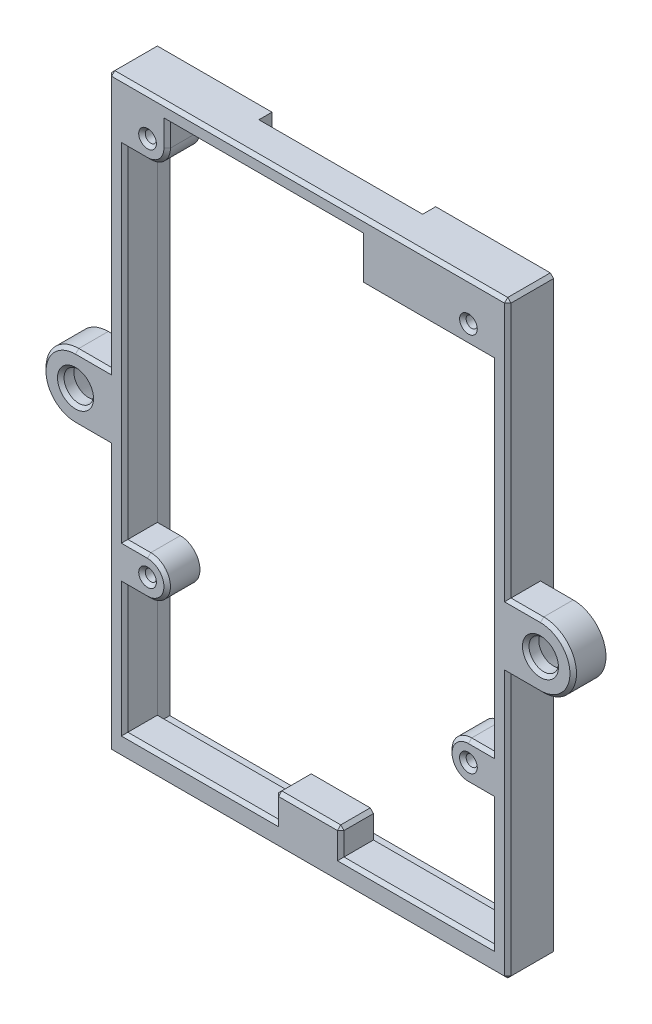
from build123d import *
from OCP.BRepFilletAPI import BRepFilletAPI_MakeChamfer

# Parameters (mm, degrees)
SKETCH1_R           = 0.85
BOSS_EXTRUDE1_DEPTH = 5
SKETCH2_W           = 56.2
SKETCH2_H           = 85.2
BOSS_EXTRUDE2_DEPTH = 2
SKETCH3_R           = 2.25
BOSS_EXTRUDE3_DEPTH = 5
SKETCH4_R           = 3.5
CUT_EXTRUDE1_DEPTH  = 3
SKETCH5_W           = 25
SKETCH5_H           = 2.4
CUT_EXTRUDE2_DEPTH  = 62.118736898
CHAMFER3_SIZE       = 0.5
CHAMFER1_SIZE       = 2.5
CHAMFER1_SIZE_2     = 1.25


with BuildPart() as part:
    # Sketch1 → Boss-Extrude1 (new body)
    with BuildSketch(Plane.XY):
        Polygon((-30.5, -43), (-30.5, 44.5), (30.5, 44.5), (30.5, -43), (30.5, -45.5), (-30.5, -45.5), align=None)
        with Locations((-24.5, 38.5)):
            Circle(SKETCH1_R, mode=Mode.SUBTRACT)
        with Locations((24.5, 38.5)):
            Circle(SKETCH1_R, mode=Mode.SUBTRACT)
        with Locations((24.5, -19.5)):
            Circle(SKETCH1_R, mode=Mode.SUBTRACT)
        with Locations((-24.5, -19.5)):
            Circle(SKETCH1_R, mode=Mode.SUBTRACT)
        with BuildLine():
            Line((-21.5, 38.5), (-21.5, 42))
            Line((-21.5, 42), (8, 42))
            Line((8, 42), (8, 35.5))
            Line((8, 35.5), (24.5, 35.5))
            Line((24.5, 35.5), (28, 35.5))
            Line((28, 35.5), (28, -16.5))
            Line((28, -16.5), (24.5, -16.5))
            ThreePointArc((24.5, -16.5), (21.5, -19.5), (24.5, -22.5))
            Line((24.5, -22.5), (28, -22.5))
            Line((28, -22.5), (28, -42))
            Line((28, -42), (5, -42))
            Line((5, -42), (5, -38))
            Line((5, -38), (0, -38))
            Line((0, -38), (-5, -38))
            Line((-5, -38), (-5, -42))
            Line((-5, -42), (-28, -42))
            Line((-28, -42), (-28, -22.5))
            Line((-28, -22.5), (-24.5, -22.5))
            ThreePointArc((-24.5, -22.5), (-21.5, -19.5), (-24.5, -16.5))
            Line((-24.5, -16.5), (-28, -16.5))
            Line((-28, -16.5), (-28, 35.5))
            Line((-28, 35.5), (-24.5, 35.5))
            ThreePointArc((-24.5, 35.5), (-22.378679656, 36.378679656), (-21.5, 38.5))
        make_face(mode=Mode.SUBTRACT)
    extrude(amount=BOSS_EXTRUDE1_DEPTH)

    # Sketch2 → Boss-Extrude2 (add)
    with BuildSketch(Plane.XY):
        Polygon((30.5, -45.5), (30.5, 44.5), (-30.5, 44.5), (-30.5, -45.5), (-28.1, -45.5), (28.1, -45.5), align=None)
        with Locations((0, -0.5)):
            Rectangle(SKETCH2_W, SKETCH2_H, mode=Mode.SUBTRACT)
    extrude(amount=-BOSS_EXTRUDE2_DEPTH)

    # Sketch3 → Boss-Extrude3 (add)
    # profile 1 of 2: a face of its own
    with BuildSketch(Plane.XY):
        with BuildLine():
            Line((35.5, 5), (30.5, 5))
            Line((30.5, 5), (30.5, -5))
            Line((30.5, -5), (35.5, -5))
            ThreePointArc((35.5, -5), (40.5, 0), (35.5, 5))
        make_face()
        with Locations(Location((35.5, 0, 0), (0, 0, 180))):
            Circle(SKETCH3_R, mode=Mode.SUBTRACT)
    # profile 2 of 2: a face of its own
    with BuildSketch(Plane.XY):
        with BuildLine():
            Line((-35.5, 5), (-30.5, 5))
            Line((-30.5, 5), (-30.5, -5))
            Line((-30.5, -5), (-35.5, -5))
            ThreePointArc((-35.5, -5), (-40.5, 0), (-35.5, 5))
        make_face()
        with Locations(Location((-35.5, 0, 0), (0, 0, 180))):
            Circle(SKETCH3_R, mode=Mode.SUBTRACT)
    extrude(amount=BOSS_EXTRUDE3_DEPTH)

    # Sketch4 → Cut-Extrude1 (cut)
    with BuildSketch(Plane(origin=(0, 0, 0), x_dir=(-1, 0, 0), z_dir=(0, 0, -1))):
        with Locations((-35.5, 0)):
            Circle(SKETCH4_R)
        with Locations((35.5, 0)):
            Circle(SKETCH4_R)
    extrude(amount=-CUT_EXTRUDE1_DEPTH, mode=Mode.SUBTRACT)

    # Sketch5 → Cut-Extrude2 (cut, through all)
    with BuildSketch(Plane(origin=(0, 0, 0), x_dir=(-1, 0, 0), z_dir=(0, 0, -1))):
        with Locations((0, 43.3)):
            Rectangle(SKETCH5_W, SKETCH5_H)
    extrude(amount=CUT_EXTRUDE2_DEPTH, mode=Mode.SUBTRACT)

    # Chamfer3
    chamfer3_edges = [part.edges().sort_by_distance(p)[0] for p in [
        (30.5, 44.5, 1.5),
        (30.5, -45.5, 1.5),
        (-30.5, -45.5, 1.5),
        (-30.5, 44.5, 1.5),
        (30.5, 24.75, 5),
        (40.5, 0, 5),
        (33, 5, 5),
        (33, -5, 5),
        (37.75, 0, 5),
        (-30.5, -25.25, 5),
        (-40.5, 0, 5),
        (-33, -5, 5),
        (-33, 5, 5),
        (-33.25, 0, 5),
        (0, -45.5, 5),
        (-25.35, 38.5, 0),
        (-25.35, 38.5, 5),
        (30.5, -25.25, 5),
        (23.65, 38.5, 0),
        (23.65, 38.5, 5),
        (-5, -38, 2.5),
        (5, -38, 2.5),
        (0, 44.5, 5),
        (8, 35.5, 2.5),
        (-22.378679656, 36.378679656, 5),
        (-26.25, 35.5, 5),
        (-28, 9.5, 5),
        (-26.25, -16.5, 5),
        (-21.5, -19.5, 5),
        (-26.25, -22.5, 5),
        (-28, -32.25, 5),
        (-16.5, -42, 5),
        (-5, -40, 5),
        (0, -38, 5),
        (5, -40, 5),
        (16.5, -42, 5),
        (28, -32.25, 5),
        (26.25, -22.5, 5),
        (21.5, -19.5, 5),
        (26.25, -16.5, 5),
        (28, 9.5, 5),
        (18, 35.5, 5),
        (8, 38.75, 5),
        (-6.75, 42, 5),
        (-21.5, 40.25, 5),
        (23.65, -19.5, 0),
        (23.65, -19.5, 5),
        (-25.35, -19.5, 0),
        (-25.35, -19.5, 5),
        (-30.5, 24.75, 5),
    ]]
    chamfer(chamfer3_edges, length=CHAMFER3_SIZE)

    # Chamfer1
    chamfer1_edges_1 = [part.edges().sort_by_distance(p)[0] for p in [
        (39, 0, 3),
    ]]
    chamfer1_side_1 = [part.faces().sort_by_distance(p)[0] for p in [
        (39, 0, 2.975),
    ]]
    chamfer1_edges_2 = [part.edges().sort_by_distance(p)[0] for p in [
        (-32, 0, 3),
    ]]
    chamfer1_side_2 = [part.faces().sort_by_distance(p)[0] for p in [
        (-32, 0, 2.975),
    ]]
    chamfer1 = BRepFilletAPI_MakeChamfer(part.part.solid().wrapped)
    for e in chamfer1_edges_1:
        chamfer1.Add(CHAMFER1_SIZE - 0.0001, CHAMFER1_SIZE_2 - 0.0001, e.wrapped, chamfer1_side_1[0].wrapped)
    for e in chamfer1_edges_2:
        chamfer1.Add(CHAMFER1_SIZE - 0.0001, CHAMFER1_SIZE_2 - 0.0001, e.wrapped, chamfer1_side_2[0].wrapped)
    add(Compound.cast(chamfer1.Shape()), mode=Mode.REPLACE)  # a hair under: the kernel refuses the full size


solid = part.part
